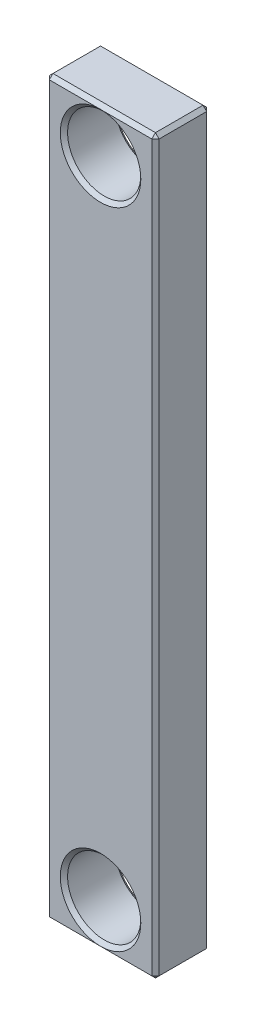
from build123d import *

# Parameters (mm, degrees)
SKETCH1_W           = 30
SKETCH1_H           = 200
SKETCH1_R           = 10
BOSS_EXTRUDE1_DEPTH = 15
CHAMFER1_SIZE       = 1


with BuildPart() as part:
    # Sketch1 → Boss-Extrude1 (new body)
    with BuildSketch(Plane.XY):
        Rectangle(SKETCH1_W, SKETCH1_H)
        with Locations((0, 88)):
            Circle(SKETCH1_R, mode=Mode.SUBTRACT)
        with Locations((0, -88)):
            Circle(SKETCH1_R, mode=Mode.SUBTRACT)
    extrude(amount=BOSS_EXTRUDE1_DEPTH)

    # Chamfer1
    chamfer1_edges = [part.edges().sort_by_distance(p)[0] for p in [
        (-15, 0, 15),
        (-10, 88, 0),
        (-10, 88, 15),
        (0, -100, 15),
        (-10, -88, 0),
        (-10, -88, 15),
        (15, 0, 15),
        (0, -100, 0),
        (-15, 0, 0),
        (0, 100, 0),
        (15, 0, 0),
        (0, 100, 15),
        (15, -100, 7.5),
        (-15, -100, 7.5),
        (-15, 100, 7.5),
        (15, 100, 7.5),
    ]]
    chamfer(chamfer1_edges, length=CHAMFER1_SIZE - 0.0001)  # a hair under: the kernel refuses the full size


solid = part.part
